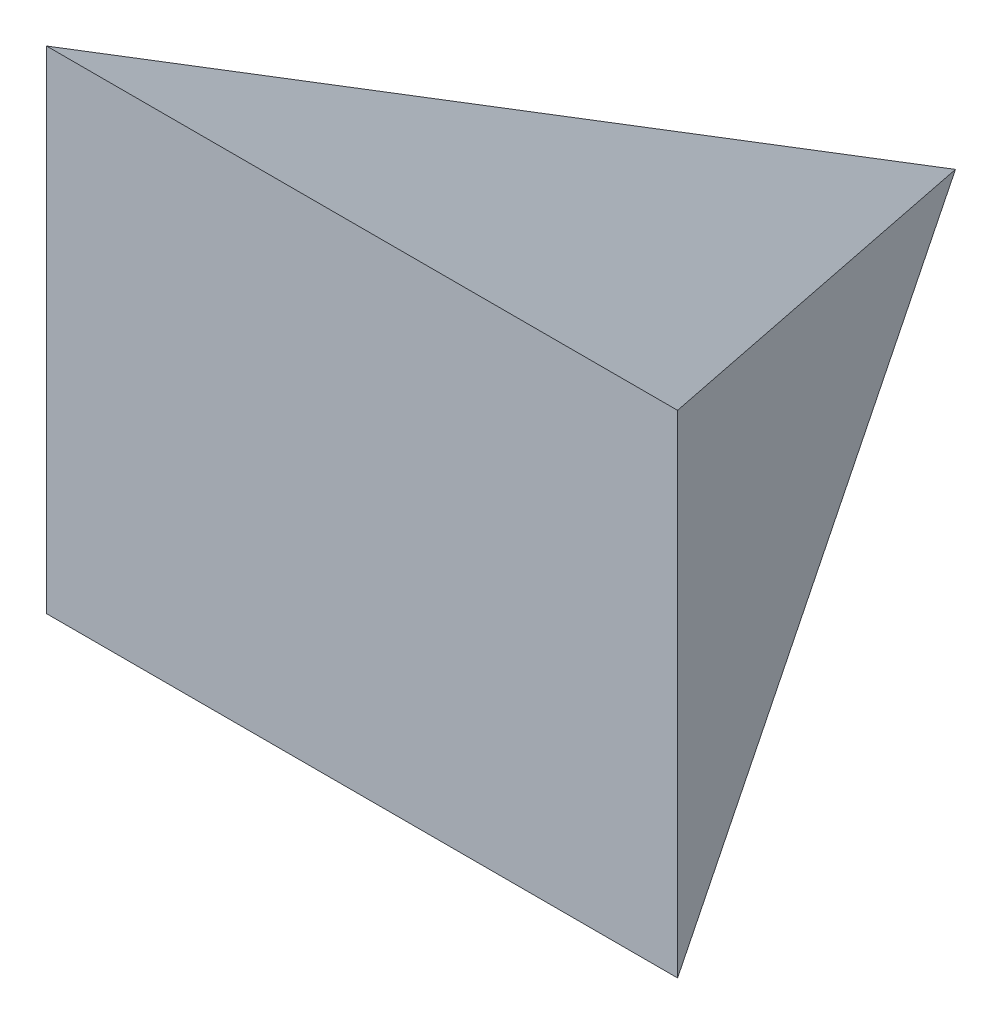
from build123d import *

# Parameters (mm, degrees)
BOSS_EXTRUDE1_DEPTH     = 200
CUT_EXTRUDE1_DEPTH      = 303.173123869
CUT_EXTRUDE1_DEPTH_BACK = 303.173123869
SKETCH2_OUTSIDE_W       = 272.776
SKETCH2_OUTSIDE_H       = 272.776


with BuildPart() as part:
    # Sketch1 → Boss-Extrude1 (new body)
    with BuildSketch(Plane(origin=(0, 0, 0), x_dir=(1, 0, 0), z_dir=(0, 1, 0))):
        Polygon((0, 0), (-106.341886332, -200), (106.341886332, -200), align=None)
    extrude(amount=BOSS_EXTRUDE1_DEPTH)

    # Sketch2 outside → Cut-Extrude1 (cut, two sides: drawn at the far end of the back side and taken through both)
    with BuildSketch(Plane(origin=(0, 0, 0), x_dir=(0, 0, -1), z_dir=(1, 0, 0)).offset(-CUT_EXTRUDE1_DEPTH_BACK)):
        with Locations((-100, 100)):
            Rectangle(SKETCH2_OUTSIDE_W, SKETCH2_OUTSIDE_H)
        Polygon((0, 100), (-200, 182.842712475), (-200, 17.157287525), align=None, mode=Mode.SUBTRACT)
    extrude(amount=CUT_EXTRUDE1_DEPTH + CUT_EXTRUDE1_DEPTH_BACK, mode=Mode.SUBTRACT)


solid = part.part
